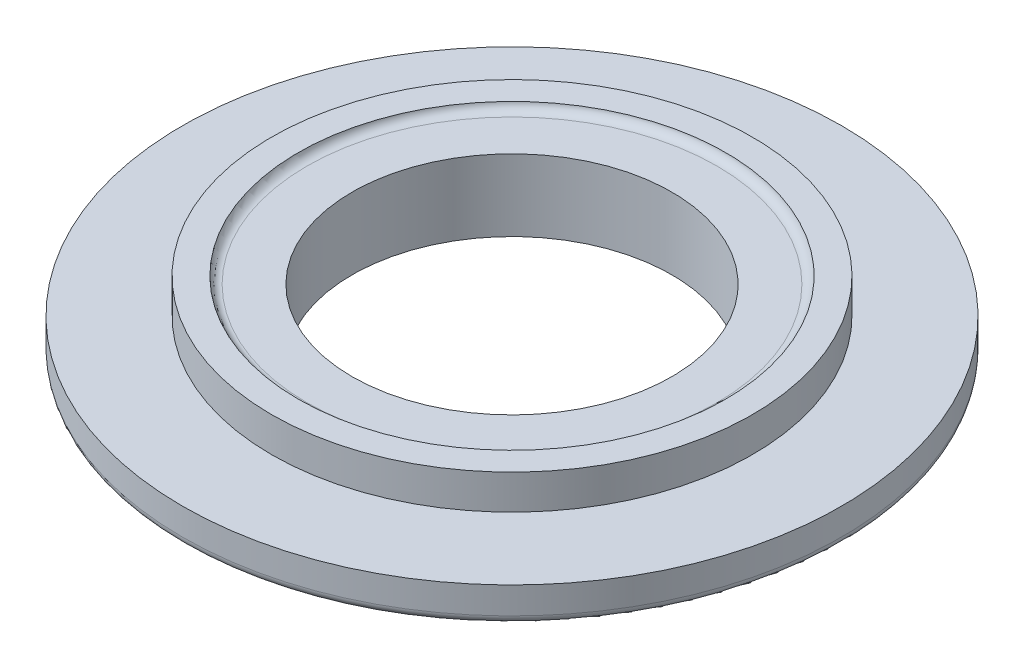
from build123d import *

# Parameters (mm, degrees)
FILLET3_R = 1.7
FILLET4_R = 1.7


with BuildPart() as part:
    # Sketch1 → Revolve2 (revolve)
    with BuildSketch(Plane.XY, mode=Mode.PRIVATE) as revolve2_sk:
        Polygon((-3.114208506, -0.827200396), (7.306092253, -0.827200396), (7.306092253, -14.720657828), (3.953440281, -14.720657828), (3.953440281, -6.120657828), (-1.56177698, -6.120657828), (-1.56177698, -13.020657828), (-25.583612163, -13.020657828), (-25.583612163, -6.120657828), (-8.302598077, -6.120657828), (-8.302598077, 0.602670746), (-3.114208506, 0.602670746), align=None)
    revolve(revolve2_sk.sketch.rotate(Axis((38.306092253, 0.602670746, 0), (0, -1, 0)), 270), axis=Axis((38.306092253, 0.602670746, 0), (0, -1, 0)))

    # Fillet3
    # the kernel refuses this fillet: 1.7 mm, written as the material it adds along each edge
    with BuildSketch(Plane(origin=(38.306092253, -0.827200396, 0), x_dir=(0, 0, 1), z_dir=(1, 0, 0))) as fillet3_piece_1:
        with BuildLine():
            CenterArc((39.741899614, -1.7), FILLET3_R, 9.143015085, 80.856984915)
            Line((41.420300758, -1.429871142), (41.453868781, -1.424468565))
            ThreePointArc((41.453868781, -1.424468565), (41.454300758, -0.714935571), (41.454300758, 0))
            Line((41.454300758, 0), (41.420300758, 0.034))
            Line((41.420300758, 0.034), (39.741899614, 0.034))
            Line((39.741899614, 0.034), (39.741899614, 0))
        make_face()
    revolve(axis=Axis((38.306092253, -0.827200396, 0), (0, -1, 0)))

    # Fillet4
    fillet4_edges = [part.edges().sort_by_distance(p)[0] for p in [
        (38.306092253, -13.020657828, -63.889704416),
    ]]
    fillet(fillet4_edges, radius=FILLET4_R)


solid = part.part
